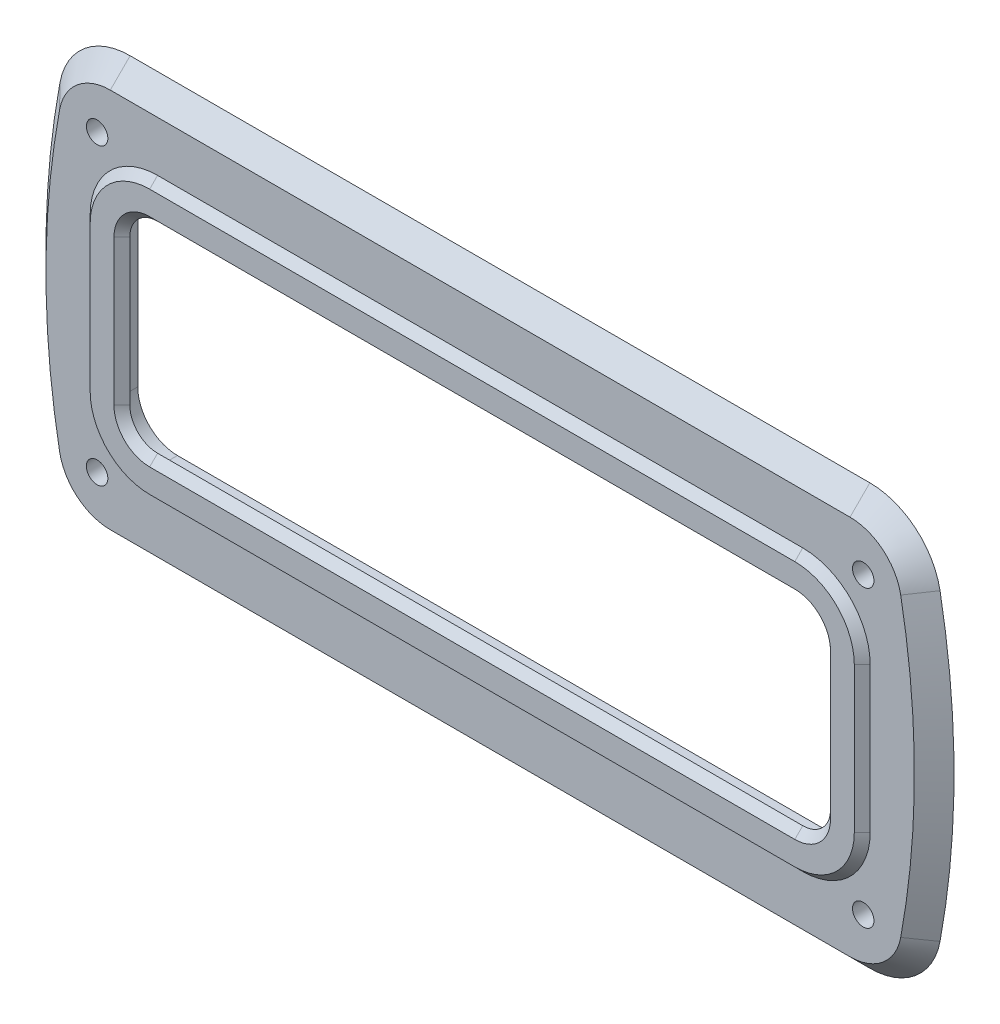
from build123d import *

# Parameters (mm, degrees)
SKETCH1_R           = 1.35
SKETCH1_R_2         = 1.353883359
BOSS_EXTRUDE1_DEPTH = 2.5
BOSS_EXTRUDE2_DEPTH = 1
CHAMFER1_SIZE       = 1
CHAMFER2_SIZE       = 2.5


with BuildPart() as part:
    # Sketch1 → Boss-Extrude1 (new body)
    with BuildSketch(Plane.XY):
        with BuildLine():
            Line((-46.266968928, -27.305569911), (46.983031072, -27.305569911))
            ThreePointArc((46.983031072, -27.305569911), (52.736028884, -25.226770397), (55.831398017, -19.950684615))
            ThreePointArc((55.831398017, -19.950684615), (57.596036195, -0.805569911), (55.831398017, 18.339544793))
            ThreePointArc((55.831398017, 18.339544793), (52.736028884, 23.615630575), (46.983031072, 25.694430089))
            Line((46.983031072, 25.694430089), (-46.266968928, 25.694430089))
            ThreePointArc((-46.266968928, 25.694430089), (-52.019966741, 23.615630575), (-55.115335874, 18.339544793))
            ThreePointArc((-55.115335874, 18.339544793), (-56.879974052, -0.805569911), (-55.115335874, -19.950684615))
            ThreePointArc((-55.115335874, -19.950684615), (-52.019966741, -25.226770397), (-46.266968928, -27.305569911))
        make_face()
        with Locations((48.647296931, -19.366437107)):
            Circle(SKETCH1_R, mode=Mode.SUBTRACT)
        with Locations((48.647296931, 17.755297285)):
            Circle(SKETCH1_R, mode=Mode.SUBTRACT)
        with Locations((-47.931234788, 17.755297285)):
            Circle(SKETCH1_R, mode=Mode.SUBTRACT)
        with Locations((-47.931234788, -19.366437107)):
            Circle(SKETCH1_R_2, mode=Mode.SUBTRACT)
        with BuildLine():
            Line((-40.306968928, -14.970569911), (41.023031072, -14.970569911))
            ThreePointArc((41.023031072, -14.970569911), (44.558564977, -13.506103817), (46.023031072, -9.970569911))
            Line((46.023031072, -9.970569911), (46.023031072, 8.359430089))
            ThreePointArc((46.023031072, 8.359430089), (44.558564977, 11.894963995), (41.023031072, 13.359430089))
            Line((41.023031072, 13.359430089), (-40.306968928, 13.359430089))
            ThreePointArc((-40.306968928, 13.359430089), (-43.842502834, 11.894963995), (-45.306968928, 8.359430089))
            Line((-45.306968928, 8.359430089), (-45.306968928, -9.970569911))
            ThreePointArc((-45.306968928, -9.970569911), (-43.842502834, -13.506103817), (-40.306968928, -14.970569911))
        make_face(mode=Mode.SUBTRACT)
    extrude(amount=BOSS_EXTRUDE1_DEPTH)

    # Sketch2 → Boss-Extrude2 (add)
    with BuildSketch(Plane.XY.offset(2.5)):
        with BuildLine():
            Line((49.523031072, -9.970569911), (49.523031072, 8.359430089))
            ThreePointArc((49.523031072, 8.359430089), (47.033438712, 14.369837729), (41.023031072, 16.859430089))
            Line((41.023031072, 16.859430089), (-40.306968928, 16.859430089))
            ThreePointArc((-40.306968928, 16.859430089), (-46.317376569, 14.369837729), (-48.806968928, 8.359430089))
            Line((-48.806968928, 8.359430089), (-48.806968928, -9.970569911))
            ThreePointArc((-48.806968928, -9.970569911), (-46.317376569, -15.980977551), (-40.306968928, -18.470569911))
            Line((-40.306968928, -18.470569911), (41.023031072, -18.470569911))
            ThreePointArc((41.023031072, -18.470569911), (47.033438712, -15.980977551), (49.523031072, -9.970569911))
        make_face()
        with BuildLine():
            Line((41.023031072, 11.859430089), (-40.306968928, 11.859430089))
            ThreePointArc((-40.306968928, 11.859430089), (-42.781842663, 10.834303823), (-43.806968928, 8.359430089))
            Line((-43.806968928, 8.359430089), (-43.806968928, -9.970569911))
            ThreePointArc((-43.806968928, -9.970569911), (-42.781842663, -12.445443645), (-40.306968928, -13.470569911))
            Line((-40.306968928, -13.470569911), (41.023031072, -13.470569911))
            ThreePointArc((41.023031072, -13.470569911), (43.497904806, -12.445443645), (44.523031072, -9.970569911))
            Line((44.523031072, -9.970569911), (44.523031072, 8.359430089))
            ThreePointArc((44.523031072, 8.359430089), (43.497904806, 10.834303823), (41.023031072, 11.859430089))
        make_face(mode=Mode.SUBTRACT)
    extrude(amount=BOSS_EXTRUDE2_DEPTH)

    # Chamfer1
    chamfer1_edges = [part.edges().sort_by_distance(p)[0] for p in [
        (-42.781842663, 10.834303823, 3.5),
        (-43.806968928, -0.805569911, 3.5),
        (-42.781842663, -12.445443645, 3.5),
        (0.358031072, -13.470569911, 3.5),
        (43.497904806, -12.445443645, 3.5),
        (44.523031072, -0.805569911, 3.5),
        (43.497904806, 10.834303823, 3.5),
        (0.358031072, 11.859430089, 3.5),
        (49.523031072, -0.805569911, 3.5),
        (47.033438712, -15.980977551, 3.5),
        (0.358031072, -18.470569911, 3.5),
        (-46.317376569, -15.980977551, 3.5),
        (-48.806968928, -0.805569911, 3.5),
        (-46.317376569, 14.369837729, 3.5),
        (0.358031072, 16.859430089, 3.5),
        (47.033438712, 14.369837729, 3.5),
    ]]
    chamfer(chamfer1_edges, length=CHAMFER1_SIZE - 0.0001)  # a hair under: the kernel refuses the full size

    # Chamfer2
    chamfer2_edges = [part.edges().sort_by_distance(p)[0] for p in [
        (0.358031072, -27.305569911, 2.5),
        (52.736028884, -25.226770397, 2.5),
        (-52.019966741, -25.226770397, 2.5),
        (57.596036195, -0.805569911, 2.5),
        (-56.879974052, -0.805569911, 2.5),
        (52.736028884, 23.615630575, 2.5),
        (-52.019966741, 23.615630575, 2.5),
        (0.358031072, 25.694430089, 2.5),
    ]]
    chamfer(chamfer2_edges, length=CHAMFER2_SIZE - 0.0001)  # a hair under: the kernel refuses the full size


solid = part.part
